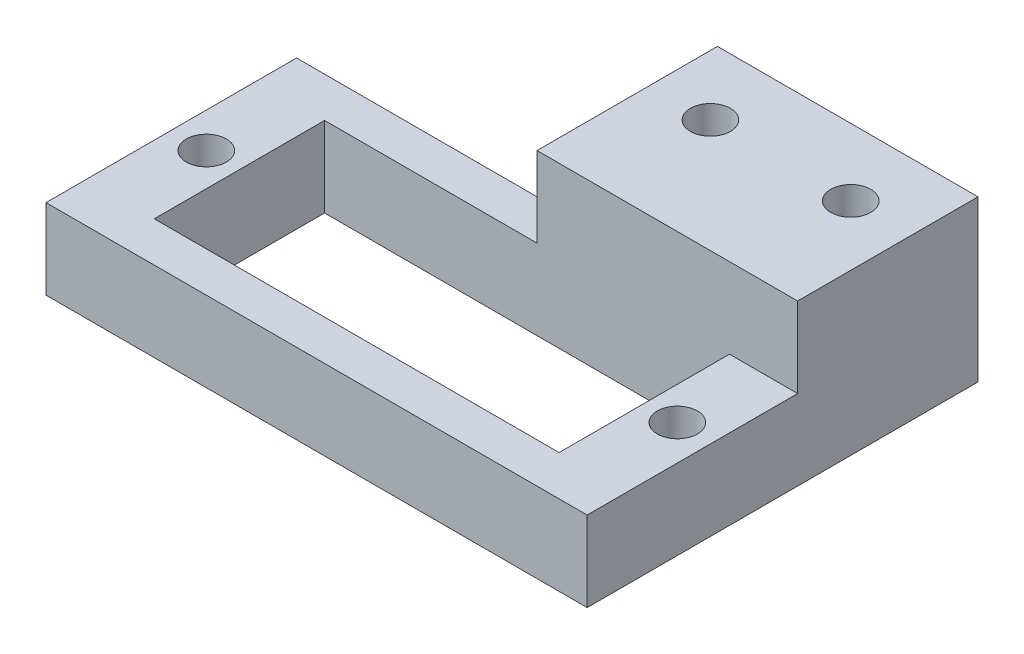
from build123d import *

# Parameters (mm, degrees)
SZKIC1_R                    = 1
SZKIC1_W                    = 20.2
SZKIC1_H                    = 8.5
DODANIE_WYCI_GNI_CIE2_DEPTH = 4
SZKIC3_W                    = 13
SZKIC3_H                    = 9
DODANIE_WYCI_GNI_CIE3_DEPTH = 4
SZKIC1_3_R                  = 1
WYTNIJ_WYCI_GNI_CIE2_DEPTH  = 19.474644787


with BuildPart() as part:
    # Szkic1 → Dodanie-wyciągnięcie2 (new body)
    with BuildSketch(Plane(origin=(0, 0, 0), x_dir=(1, 0, 0), z_dir=(0, 1, 0))):
        Polygon((-13.5, 2.75), (0.5, 2.75), (0.5, 9.75), (13.5, 9.75), (13.5, -9.75), (-13.5, -9.75), align=None)
        with Locations((11.75, -3.5)):
            Circle(SZKIC1_R, mode=Mode.SUBTRACT)
        with Locations((-11.75, -3.5)):
            Circle(SZKIC1_R, mode=Mode.SUBTRACT)
        with Locations((3.5, 6.4)):
            Circle(SZKIC1_R, mode=Mode.SUBTRACT)
        with Locations((10.5, 6.4)):
            Circle(SZKIC1_R, mode=Mode.SUBTRACT)
        with Locations((0, -3.5)):
            Rectangle(SZKIC1_W, SZKIC1_H, mode=Mode.SUBTRACT)
    extrude(amount=DODANIE_WYCI_GNI_CIE2_DEPTH)

    # Szkic3 → Dodanie-wyciągnięcie3 (add)
    with BuildSketch(Plane.XZ.offset(-4)):
        with Locations((7, -5.25)):
            Rectangle(SZKIC3_W, SZKIC3_H)
    extrude(amount=-DODANIE_WYCI_GNI_CIE3_DEPTH)

    # Szkic1<3> → Wytnij-wyciągnięcie2 (cut, through all)
    with BuildSketch(Plane(origin=(0, 0, 0), x_dir=(1, 0, 0), z_dir=(0, 1, 0))):
        with Locations((3.5, 6.4)):
            Circle(SZKIC1_3_R)
        with Locations((10.5, 6.4)):
            Circle(SZKIC1_3_R)
    extrude(amount=WYTNIJ_WYCI_GNI_CIE2_DEPTH, mode=Mode.SUBTRACT)


solid = part.part
